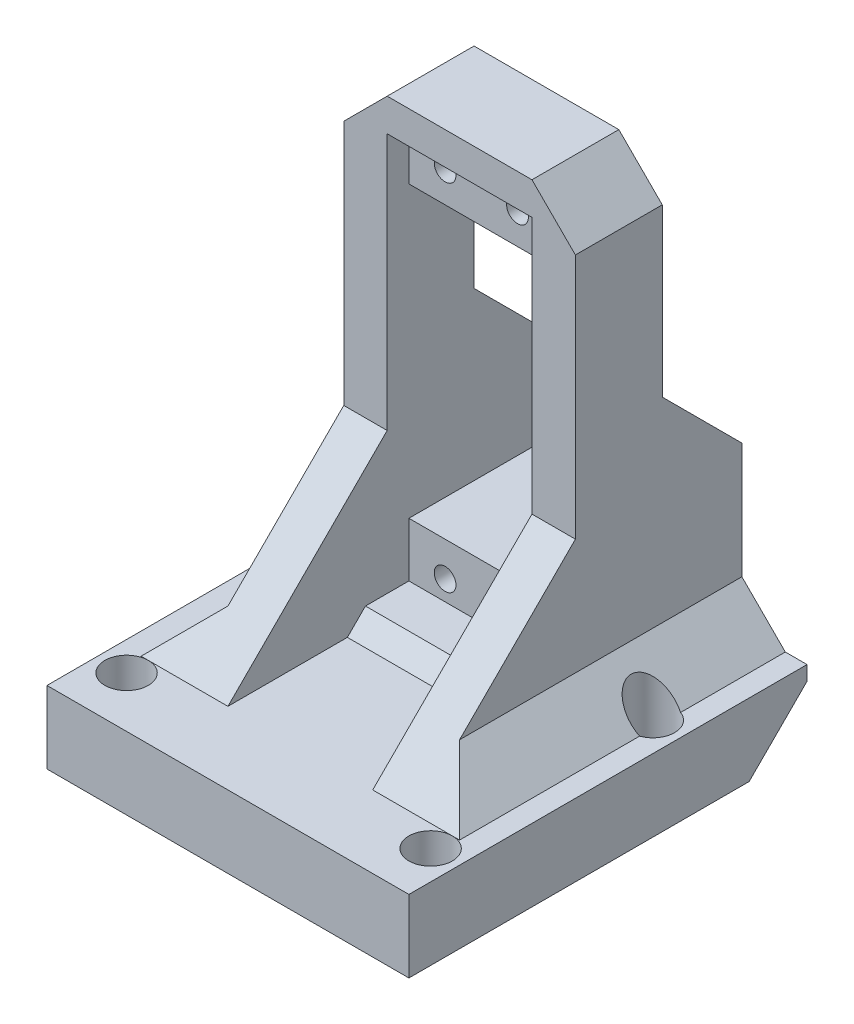
from build123d import *

# Parameters (mm, degrees)
SKETCH1_W           = 50
SKETCH1_H           = 55
BOSS_EXTRUDE1_DEPTH = 10
SKETCH2_R           = 1.5
CUT_EXTRUDE1_DEPTH  = 4
CUT_EXTRUDE2_REACH  = 39.646
SKETCH3_R           = 3
SKETCH4_W           = 20
SKETCH4_H           = 20
BOSS_EXTRUDE2_DEPTH = 10
BOSS_EXTRUDE3_DEPTH = 6
SKETCH6_W           = 12
SKETCH6_H           = 12
BOSS_EXTRUDE4_DEPTH = 32
SKETCH7_W           = 20
SKETCH7_H           = 2.5
BOSS_EXTRUDE5_DEPTH = 6
SKETCH8_W           = 20
SKETCH8_H           = 7.5
CUT_EXTRUDE3_DEPTH  = 3
CHAMFER1_SIZE       = 2.5
CUT_EXTRUDE4_REACH  = 85.869
SKETCH9_R           = 1.5
CHAMFER3_SIZE       = 6
CHAMFER4_SIZE       = 8


# Some blends are built 0.0001 mm under size
with BuildPart() as part:
    # Sketch1 → Boss-Extrude1 (new body)
    with BuildSketch(Plane(origin=(0, 0, 0), x_dir=(1, 0, 0), z_dir=(0, 1, 0))):
        Rectangle(SKETCH1_W, SKETCH1_H)
    extrude(amount=BOSS_EXTRUDE1_DEPTH)

    # Sketch2 → Cut-Extrude1 (cut)
    with BuildSketch(Plane.XZ):
        with Locations(Location((-21, 20.5, 0), (0, 0, 270))):
            Circle(SKETCH2_R)
        with Locations(Location((21, 20.5, 0), (0, 0, 270))):
            Circle(SKETCH2_R)
        with Locations(Location((21, -10.2, 0), (0, 0, 270))):
            Circle(SKETCH2_R)
        with Locations(Location((-21, -10.2, 0), (0, 0, 270))):
            Circle(SKETCH2_R)
    extrude(amount=-CUT_EXTRUDE1_DEPTH, mode=Mode.SUBTRACT)

    # Sketch3 → Cut-Extrude2 (cut, up to next)
    with BuildSketch(Plane.XZ.offset(-4), mode=Mode.PRIVATE) as cut_extrude2_sk1:
        with Locations(Location((-21, 20.5, 0), (0, 0, 270))):
            Circle(SKETCH3_R)
    cut_extrude2_tool1 = extrude(cut_extrude2_sk1.sketch, amount=-CUT_EXTRUDE2_REACH, mode=Mode.PRIVATE) & part.part
    # Sketch3 → Cut-Extrude2 (cut, up to next)
    with BuildSketch(Plane.XZ.offset(-4), mode=Mode.PRIVATE) as cut_extrude2_sk2:
        with Locations(Location((21, 20.5, 0), (0, 0, 270))):
            Circle(SKETCH3_R)
    cut_extrude2_tool2 = extrude(cut_extrude2_sk2.sketch, amount=-CUT_EXTRUDE2_REACH, mode=Mode.PRIVATE) & part.part
    # Sketch3 → Cut-Extrude2 (cut, up to next)
    with BuildSketch(Plane.XZ.offset(-4), mode=Mode.PRIVATE) as cut_extrude2_sk3:
        with Locations(Location((21, -10.2, 0), (0, 0, 270))):
            Circle(SKETCH3_R)
    cut_extrude2_tool3 = extrude(cut_extrude2_sk3.sketch, amount=-CUT_EXTRUDE2_REACH, mode=Mode.PRIVATE) & part.part
    # Sketch3 → Cut-Extrude2 (cut, up to next)
    with BuildSketch(Plane.XZ.offset(-4), mode=Mode.PRIVATE) as cut_extrude2_sk4:
        with Locations(Location((-21, -10.2, 0), (0, 0, 270))):
            Circle(SKETCH3_R)
    cut_extrude2_tool4 = extrude(cut_extrude2_sk4.sketch, amount=-CUT_EXTRUDE2_REACH, mode=Mode.PRIVATE) & part.part
    add(cut_extrude2_tool1.solids().sort_by_distance((-21, 4, 20.5))[0], mode=Mode.SUBTRACT)
    add(cut_extrude2_tool2.solids().sort_by_distance((21, 4, 20.5))[0], mode=Mode.SUBTRACT)
    add(cut_extrude2_tool3.solids().sort_by_distance((21, 4, -10.2))[0], mode=Mode.SUBTRACT)
    add(cut_extrude2_tool4.solids().sort_by_distance((-21, 4, -10.2))[0], mode=Mode.SUBTRACT)

    # Sketch4 → Boss-Extrude2 (add)
    with BuildSketch(Plane(origin=(0, 10, 0), x_dir=(1, 0, 0), z_dir=(0, 1, 0))):
        with Locations((0, 17.5)):
            Rectangle(SKETCH4_W, SKETCH4_H)
    extrude(amount=BOSS_EXTRUDE2_DEPTH)

    # Sketch5 → Boss-Extrude3 (add)
    with BuildSketch(Plane(origin=(10, 0, 0), x_dir=(0, 0, -1), z_dir=(1, 0, 0))):
        Polygon((-17.5, 10), (4.5, 32), (4.5, 60), (16.5, 60), (16.5, 43), (27.5, 32), (27.5, 10), align=None)
    boss_extrude3 = extrude(amount=BOSS_EXTRUDE3_DEPTH)

    # Mirror1: Boss-Extrude3 across plane
    add(boss_extrude3.mirror(Plane(origin=(0, 0, 0), x_dir=(0, 0, 1), z_dir=(1, 0, 0))))

    # Sketch6 → Boss-Extrude4 (add)
    with BuildSketch(Plane(origin=(16, 0, 0), x_dir=(0, 0, -1), z_dir=(1, 0, 0))):
        with Locations((10.5, 66)):
            Rectangle(SKETCH6_W, SKETCH6_H)
    extrude(amount=-BOSS_EXTRUDE4_DEPTH)

    # Sketch7 → Boss-Extrude5 (add)
    with BuildSketch(Plane.XY.offset(-7.5)):
        with Locations((0, 11.25)):
            Rectangle(SKETCH7_W, SKETCH7_H)
    extrude(amount=BOSS_EXTRUDE5_DEPTH)

    # Sketch8 → Cut-Extrude3 (cut)
    with BuildSketch(Plane.XY.offset(-4.5)):
        with Locations((0, 63.75)):
            Rectangle(SKETCH8_W, SKETCH8_H)
    extrude(amount=-CUT_EXTRUDE3_DEPTH, mode=Mode.SUBTRACT)

    # Chamfer1
    chamfer1_edges = [part.edges().sort_by_distance(p)[0] for p in [
        (0, 10, -1.5),
    ]]
    chamfer(chamfer1_edges, length=CHAMFER1_SIZE - 0.0001)  # a hair under: the kernel refuses the full size

    # Sketch9 → Cut-Extrude4 (cut, up to next)
    with BuildSketch(Plane.XY.offset(-7.5), mode=Mode.PRIVATE) as cut_extrude4_sk1:
        with Locations((-5, 64.25)):
            Circle(SKETCH9_R)
    cut_extrude4_tool1 = extrude(cut_extrude4_sk1.sketch, amount=-CUT_EXTRUDE4_REACH, mode=Mode.PRIVATE) & part.part
    # Sketch9 → Cut-Extrude4 (cut, up to next)
    with BuildSketch(Plane.XY.offset(-7.5), mode=Mode.PRIVATE) as cut_extrude4_sk2:
        with Locations((5, 64.25)):
            Circle(SKETCH9_R)
    cut_extrude4_tool2 = extrude(cut_extrude4_sk2.sketch, amount=-CUT_EXTRUDE4_REACH, mode=Mode.PRIVATE) & part.part
    # Sketch9 → Cut-Extrude4 (cut, up to next)
    with BuildSketch(Plane.XY.offset(-7.5), mode=Mode.PRIVATE) as cut_extrude4_sk3:
        with Locations((5, 15.25)):
            Circle(SKETCH9_R)
    cut_extrude4_tool3 = extrude(cut_extrude4_sk3.sketch, amount=-CUT_EXTRUDE4_REACH, mode=Mode.PRIVATE) & part.part
    # Sketch9 → Cut-Extrude4 (cut, up to next)
    with BuildSketch(Plane.XY.offset(-7.5), mode=Mode.PRIVATE) as cut_extrude4_sk4:
        with Locations((-5, 15.25)):
            Circle(SKETCH9_R)
    cut_extrude4_tool4 = extrude(cut_extrude4_sk4.sketch, amount=-CUT_EXTRUDE4_REACH, mode=Mode.PRIVATE) & part.part
    add(cut_extrude4_tool1.solids().sort_by_distance((-5, 64.25, -7.5))[0], mode=Mode.SUBTRACT)
    add(cut_extrude4_tool2.solids().sort_by_distance((5, 64.25, -7.5))[0], mode=Mode.SUBTRACT)
    add(cut_extrude4_tool3.solids().sort_by_distance((5, 15.25, -7.5))[0], mode=Mode.SUBTRACT)
    add(cut_extrude4_tool4.solids().sort_by_distance((-5, 15.25, -7.5))[0], mode=Mode.SUBTRACT)

    # Chamfer3
    # the kernel refuses this chamfer: 6 mm, written as the material it adds along each edge
    with BuildSketch(Plane(origin=(16, 10, -27.5), x_dir=(0.9996219169112969, -0.02749587661058649, 0), z_dir=(0, 0, 1))) as chamfer3_piece_1_section:
        Polygon((CHAMFER3_SIZE * 0.999621916911, CHAMFER3_SIZE * 0.0274958766106), (-CHAMFER3_SIZE * 0.0274958766106, CHAMFER3_SIZE * 0.999621916911), (0, 0), align=None)
    chamfer3_piece_1 = extrude(amount=60.430097928, mode=Mode.PRIVATE)
    chamfer3_piece_1 = split(chamfer3_piece_1, bisect_by=Plane(origin=(17.926096491, 22.613963147, 4.886036853), z_dir=(0, -0.7071067811865474, -0.7071067811865478)), keep=Keep.TOP, mode=Mode.PRIVATE)
    chamfer3_piece_1 = chamfer3_piece_1 - Plane(origin=(21, 11.966350777, 20.5), x_dir=(0, 0, -1), z_dir=(0, -1, 0)) * Cylinder(3, 145, mode=Mode.PRIVATE)
    chamfer3_piece_1 = chamfer3_piece_1 - Plane(origin=(21, 11.966350777, -10.2), x_dir=(0, 0, -1), z_dir=(0, -1, 0)) * Cylinder(3, 145, mode=Mode.PRIVATE)
    add(chamfer3_piece_1)
    with BuildSketch(Plane(origin=(-16, 10, -27.5), x_dir=(-0.9996219169112969, -0.02749587661058649, 0), z_dir=(0, 0, 1))) as chamfer3_piece_2_section:
        Polygon((CHAMFER3_SIZE * 0.999621916911, -CHAMFER3_SIZE * 0.0274958766106), (-CHAMFER3_SIZE * 0.0274958766106, -CHAMFER3_SIZE * 0.999621916911), (0, 0), align=None)
    chamfer3_piece_2 = extrude(amount=60.430097928, mode=Mode.PRIVATE)
    chamfer3_piece_2 = split(chamfer3_piece_2, bisect_by=Plane(origin=(-17.926096431, 22.613963068, 4.886036932), z_dir=(0, -0.7071067811865474, -0.7071067811865478)), keep=Keep.TOP, mode=Mode.PRIVATE)
    chamfer3_piece_2 = chamfer3_piece_2 - Plane(origin=(-21, 11.966350831, 20.5), x_dir=(0, 0, -1), z_dir=(0, -1, 0)) * Cylinder(3, 145, mode=Mode.PRIVATE)
    chamfer3_piece_2 = chamfer3_piece_2 - Plane(origin=(-21, 11.966350831, -10.2), x_dir=(0, 0, -1), z_dir=(0, -1, 0)) * Cylinder(3, 145, mode=Mode.PRIVATE)
    add(chamfer3_piece_2)
    # the kernel refuses this chamfer: 6 mm, written as the material it takes off along each edge
    with BuildSketch(Plane(origin=(16, 72, -31.930097928), x_dir=(0.02749587661058648, -0.9996219169112968, 0), z_dir=(0, 0, 1)), Plane(origin=(-16, 72, -31.930097928), x_dir=(0.9996219169112968, 0.027495876610586775, 0), z_dir=(0, 0, 1))) as chamfer3_2_piece_1:
        Polygon((CHAMFER3_SIZE * 0.999621916911, -CHAMFER3_SIZE * 0.0274958766106), (-CHAMFER3_SIZE * 0.0274958766106, -CHAMFER3_SIZE * 0.999621916911), (0, 0), align=None)
    extrude(amount=42.860195856, mode=Mode.SUBTRACT)

    # Chamfer4
    chamfer4_edges = [part.edges().sort_by_distance(p)[0] for p in [
        (0, 0, -27.5),
    ]]
    chamfer(chamfer4_edges, length=CHAMFER4_SIZE)


solid = part.part
